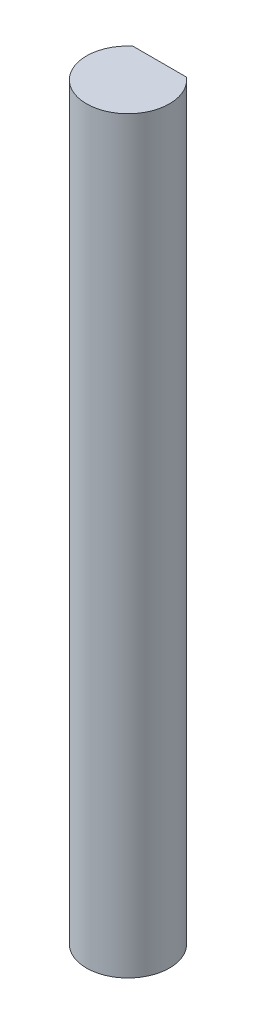
from build123d import *

# Parameters (mm, degrees)
BOSS_EXTRUDE1_DEPTH = 28.575


with BuildPart() as part:
    # Sketch1 → Boss-Extrude1 (new, symmetric)
    with BuildSketch(Plane(origin=(0, 0, 0), x_dir=(1, 0, 0), z_dir=(0, 1, 0))):
        with BuildLine():
            Line((-2.049236991, 2.41681), (2.049236991, 2.41681))
            ThreePointArc((2.049236991, 2.41681), (0, -3.16865), (-2.049236991, 2.41681))
        make_face()
    extrude(amount=BOSS_EXTRUDE1_DEPTH, both=True)


solid = part.part
